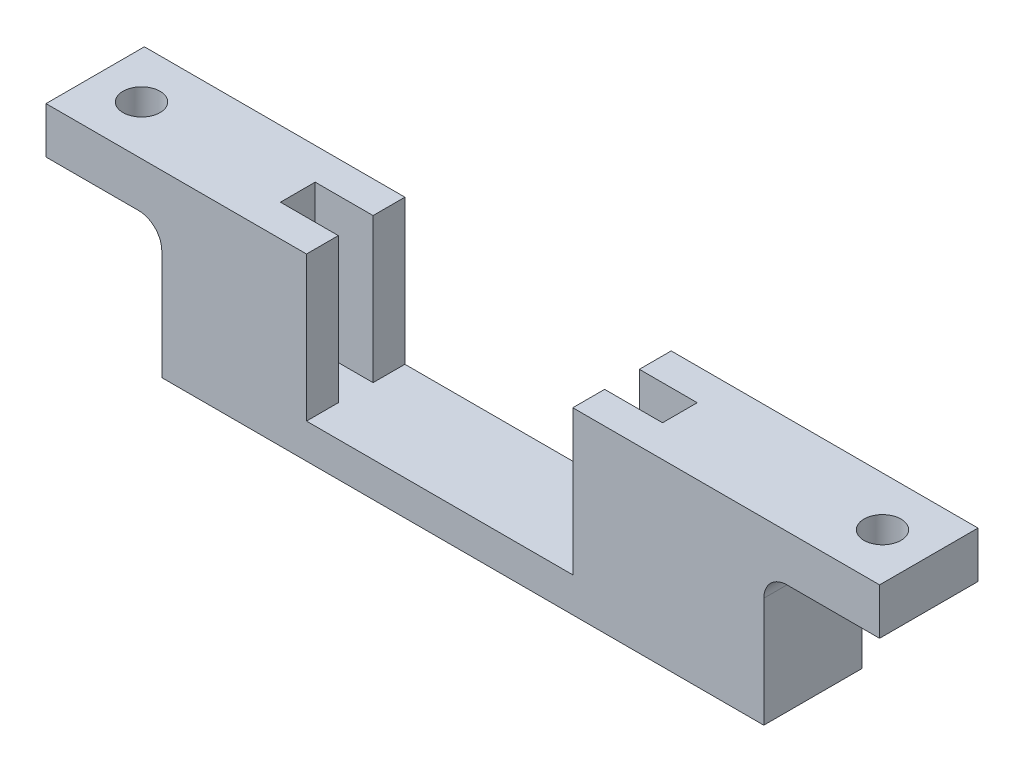
from build123d import *

# Parameters (mm, degrees)
SKETCH1_W           = 72
SKETCH1_H           = 8.5
BOSS_EXTRUDE1_DEPTH = 15.5
CUT_EXTRUDE1_DEPTH  = 12.5
SKETCH3_W           = 10
SKETCH3_H           = 8.5
CUT_EXTRUDE2_DEPTH  = 11.5
SKETCH4_R           = 1.6
CUT_EXTRUDE3_DEPTH  = 40.424770132
FILLET1_R           = 2


with BuildPart() as part:
    # Sketch1 → Boss-Extrude1 (new body)
    with BuildSketch(Plane(origin=(0, 0, 0), x_dir=(1, 0, 0), z_dir=(0, 1, 0))):
        Rectangle(SKETCH1_W, SKETCH1_H)
    extrude(amount=BOSS_EXTRUDE1_DEPTH)

    # Sketch2 → Cut-Extrude1 (cut)
    with BuildSketch(Plane(origin=(0, 15.5, 0), x_dir=(1, 0, 0), z_dir=(0, 1, 0))):
        Polygon((-13.5, -1.5), (-13.5, -4.25), (9.5, -4.25), (9.5, -1.5), (14.5, -1.5), (14.5, 1.5), (9.5, 1.5), (9.5, 4.25), (-13.5, 4.25), (-13.5, 1.5), (-18.5, 1.5), (-18.5, -1.5), align=None)
    extrude(amount=-CUT_EXTRUDE1_DEPTH, mode=Mode.SUBTRACT)

    # Sketch3 → Cut-Extrude2 (cut)
    with BuildSketch(Plane.XZ):
        with Locations((-31, 0)):
            Rectangle(SKETCH3_W, SKETCH3_H)
        with Locations((31, 0)):
            Rectangle(SKETCH3_W, SKETCH3_H)
    extrude(amount=-CUT_EXTRUDE2_DEPTH, mode=Mode.SUBTRACT)

    # Sketch4 → Cut-Extrude3 (cut, through all)
    with BuildSketch(Plane(origin=(0, 15.5, 0), x_dir=(1, 0, 0), z_dir=(0, 1, 0))):
        with Locations((-32, 0)):
            Circle(SKETCH4_R)
        with Locations((32, 0)):
            Circle(SKETCH4_R)
    extrude(amount=-CUT_EXTRUDE3_DEPTH, mode=Mode.SUBTRACT)

    # Fillet1
    fillet1_edges = [part.edges().sort_by_distance(p)[0] for p in [
        (-26, 11.5, 0),
        (26, 11.5, 0),
    ]]
    fillet(fillet1_edges, radius=FILLET1_R)


solid = part.part
